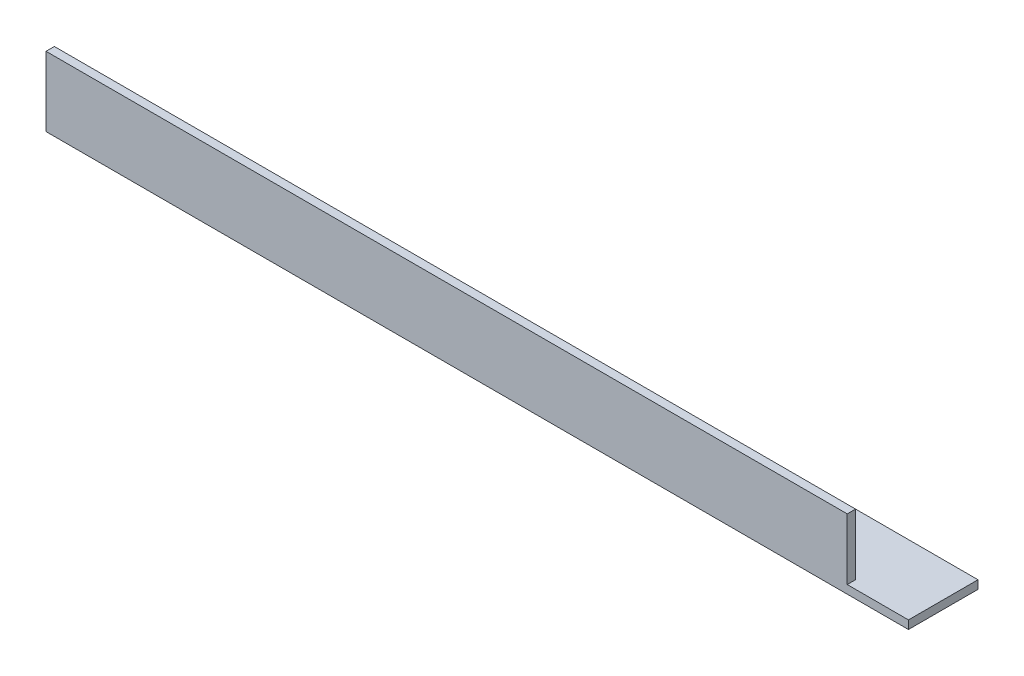
from build123d import *

# Parameters (mm, degrees)
EXTRUDE_1_DEPTH     = 310
SKETCH_2_W          = 22
SKETCH_2_H          = 22
CUT_EXTRUDE_1_DEPTH = 313.009615236


with BuildPart() as part:
    # Эскиз1 → Вытянуть-Тонкостенный1 (new body)
    with BuildSketch(Plane(origin=(0, 0, 0), x_dir=(0, 0, -1), z_dir=(1, 0, 0))):
        Polygon((0, 25), (0, 0), (25, 0), (25, 3), (3, 3), (3, 25), align=None)
    extrude(amount=EXTRUDE_1_DEPTH)

    # Эскиз2 → Вырез-Вытянуть1 (cut, through all)
    with BuildSketch(Plane.XY):
        with Locations((299, 14)):
            Rectangle(SKETCH_2_W, SKETCH_2_H)
    extrude(amount=-CUT_EXTRUDE_1_DEPTH, mode=Mode.SUBTRACT)


solid = part.part
